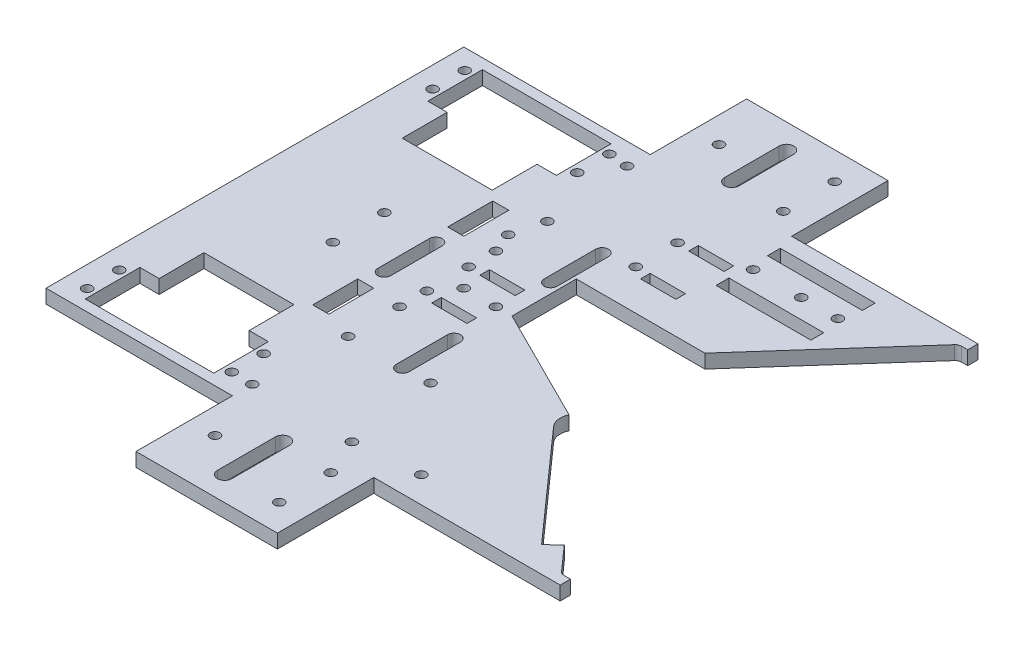
from build123d import *

# Parameters (mm, degrees)
BOSS_EXTRUDE1_DEPTH = 4.3
CUT_EXTRUDE1_DEPTH  = 4.5
FILLET1_R           = 2
CUT_EXTRUDE2_DEPTH  = 10
SKETCH8_R           = 1.5
CUT_EXTRUDE3_DEPTH  = 10
SKETCH9_R           = 1.5
CUT_EXTRUDE4_DEPTH  = 10
CUT_EXTRUDE5_DEPTH  = 10
SKETCH11_R          = 1.5
CUT_EXTRUDE6_DEPTH  = 10
SKETCH12_R          = 1.5
CUT_EXTRUDE7_DEPTH  = 10
SKETCH7_R           = 1.5
SKETCH7_W           = 11
SKETCH7_H           = 3
CUT_EXTRUDE8_DEPTH  = 9
SKETCH13_R          = 1.5
CUT_EXTRUDE9_DEPTH  = 10
SKETCH14_R          = 1.5
CUT_EXTRUDE10_DEPTH = 10
SKETCH15_W          = 5
SKETCH15_H          = 14
CUT_EXTRUDE11_DEPTH = 10
SKETCH16_R          = 1.5
CUT_EXTRUDE12_DEPTH = 10
SKETCH18_R          = 1.5
SKETCH18_W          = 29.5
SKETCH18_H          = 4
CUT_EXTRUDE13_DEPTH = 10


with BuildPart() as part:
    # Sketch2 → Boss-Extrude1 (new body)
    with BuildSketch(Plane(origin=(0, 0, 0), x_dir=(1, 0, 0), z_dir=(0, 1, 0))):
        Polygon((0, 0), (0, 65), (58, 65), (58, 95), (102, 95), (102, 65), (160, 65), (160, 0), align=None)
    extrude(amount=BOSS_EXTRUDE1_DEPTH)

    # Mirror1: part across plane


with BuildPart() as part_1:
    add(part.part)
    add(part.part.mirror(Plane(origin=(0, 4.3, 0), x_dir=(1, 0, 0), z_dir=(0, 0, -1))))

    # Sketch3 → Cut-Extrude1 (cut)
    with BuildSketch(Plane(origin=(0, 4.3, 0), x_dir=(1, 0, 0), z_dir=(0, 1, 0))):
        Polygon((160, -61.8), (160, 61.8), (157.156451185, 61.8), (120.012594795, 20), (80.012594795, 20), (80.012594795, 0), (120, -20), (157.155555556, -61.8), align=None)
    extrude(amount=-CUT_EXTRUDE1_DEPTH, mode=Mode.SUBTRACT)

    # Fillet1
    fillet1_edges = [part_1.edges().sort_by_distance(p)[0] for p in [
        (157.156451185, 2.15, -61.8),
        (157.155555556, 2.15, 61.8),
    ]]
    fillet(fillet1_edges, radius=FILLET1_R)

    # Sketch6 → Cut-Extrude2 (cut)
    with BuildSketch(Plane(origin=(0, 4.3, 0), x_dir=(1, 0, 0), z_dir=(0, 1, 0))):
        Polygon((9, -61.8), (49, -61.8), (49, -44.8), (43, -44.8), (43, -30.841820122), (15, -30.841820122), (15, -44.8), (9, -44.8), align=None)
        Polygon((9, 44.8), (15, 44.8), (15, 30.841820122), (43, 30.841820122), (43, 44.8), (49, 44.8), (49, 61.8), (9, 61.8), align=None)
    extrude(amount=-CUT_EXTRUDE2_DEPTH, mode=Mode.SUBTRACT)

    # Sketch8 → Cut-Extrude3 (cut)
    with BuildSketch(Plane(origin=(0, 4.3, 0), x_dir=(1, 0, 0), z_dir=(0, 1, 0))):
        with Locations((6.5, 58.8)):
            Circle(SKETCH8_R)
        with Locations((6.5, 48.8)):
            Circle(SKETCH8_R)
        with Locations((51.5, 48.8)):
            Circle(SKETCH8_R)
        with Locations((51.5, 58.8)):
            Circle(SKETCH8_R)
        with Locations((6.5, -48.7)):
            Circle(SKETCH8_R)
        with Locations((6.5, -58.7)):
            Circle(SKETCH8_R)
        with Locations((51.5, -58.7)):
            Circle(SKETCH8_R)
        with Locations((51.5, -48.8)):
            Circle(SKETCH8_R)
    extrude(amount=-CUT_EXTRUDE3_DEPTH, mode=Mode.SUBTRACT)

    # Sketch9 → Cut-Extrude4 (cut)
    with BuildSketch(Plane.XZ):
        with Locations((94, 70.4)):
            Circle(SKETCH9_R)
        with Locations((66, 78.4)):
            Circle(SKETCH9_R)
        with Locations((66, -78.4)):
            Circle(SKETCH9_R)
        with Locations((94, -86.4)):
            Circle(SKETCH9_R)
        with Locations((94, 86.4)):
            Circle(SKETCH9_R)
        with Locations((94, -70.4)):
            Circle(SKETCH9_R)
        with BuildLine():
            Line((75.75, 69.4), (75.75, 87.4))
            ThreePointArc((75.75, 87.4), (78, 89.65), (80.25, 87.4))
            Line((80.25, 87.4), (80.25, 69.4))
            ThreePointArc((80.25, 69.4), (78, 67.15), (75.75, 69.4))
        make_face()
        with BuildLine():
            Line((75.75, -87.4), (75.75, -70.4))
            ThreePointArc((75.75, -70.4), (78, -68.15), (80.25, -70.4))
            Line((80.25, -70.4), (80.25, -87.4))
            ThreePointArc((80.25, -87.4), (78, -89.65), (75.75, -87.4))
        make_face()
    extrude(amount=-CUT_EXTRUDE4_DEPTH, mode=Mode.SUBTRACT)

    # Sketch10 → Cut-Extrude5 (cut)
    with BuildSketch(Plane(origin=(0, 4.3, 0), x_dir=(1, 0, 0), z_dir=(0, 1, 0))):
        with BuildLine():
            Line((123.321819194, -23.737046593), (149.896372747, -53.633419341))
            Line((149.896372747, -53.633419341), (146.159326154, -56.955238535))
            Line((146.159326154, -56.955238535), (116.262953407, -23.321819194))
            ThreePointArc((116.262953407, -23.321819194), (120.29361011, -15.008628134), (123.321819194, -23.737046593))
        make_face()
    extrude(amount=-CUT_EXTRUDE5_DEPTH, mode=Mode.SUBTRACT)

    # Sketch11 → Cut-Extrude6 (cut)
    with BuildSketch(Plane.XZ):
        with BuildLine():
            ThreePointArc((79, 31.031280577), (77, 33.031280577), (75, 31.031280577))
            Line((75, 31.031280577), (75, 15.031280577))
            ThreePointArc((75, 15.031280577), (77, 13.031280577), (79, 15.031280577))
            Line((79, 15.031280577), (79, 31.031280577))
        make_face()
        with BuildLine():
            ThreePointArc((75, -31.031280577), (77, -33.031280577), (79, -31.031280577))
            Line((79, -31.031280577), (79, -15.031280577))
            ThreePointArc((79, -15.031280577), (77, -13.031280577), (75, -15.031280577))
            Line((75, -15.031280577), (75, -31.031280577))
        make_face()
        with Locations((60, 31)):
            Circle(SKETCH11_R)
        with Locations((60, 15)):
            Circle(SKETCH11_R)
        with Locations((60, -15)):
            Circle(SKETCH11_R)
        with Locations((60, -31)):
            Circle(SKETCH11_R)
    extrude(amount=-CUT_EXTRUDE6_DEPTH, mode=Mode.SUBTRACT)

    # Sketch12 → Cut-Extrude7 (cut)
    with BuildSketch(Plane(origin=(0, 0, 0), x_dir=(-1, 0, 0), z_dir=(0, -1, 0))):
        with BuildLine():
            ThreePointArc((-50.262723036, -8), (-48.262723036, -10), (-46.262723036, -8))
            Line((-46.262723036, -8), (-46.262723036, 8))
            ThreePointArc((-46.262723036, 8), (-48.262723036, 10), (-50.262723036, 8))
            Line((-50.262723036, 8), (-50.262723036, -8))
        make_face()
        with Locations((-32.262723036, -8)):
            Circle(SKETCH12_R)
        with Locations((-32.262723036, 8)):
            Circle(SKETCH12_R)
    extrude(amount=-CUT_EXTRUDE7_DEPTH, mode=Mode.SUBTRACT)

    # Sketch7 → Cut-Extrude8 (cut)
    with BuildSketch(Plane(origin=(0, 4.3, 0), x_dir=(1, 0, 0), z_dir=(0, 1, 0))):
        with Locations((60.012594795, -6.5)):
            Circle(SKETCH7_R)
        with Locations((60.012594795, 6.5)):
            Circle(SKETCH7_R)
        with Locations((86, 32.5)):
            Circle(SKETCH7_R)
        with Locations((86, 45.5)):
            Circle(SKETCH7_R)
        with Locations((69.5, -7.5)):
            Rectangle(SKETCH7_W, SKETCH7_H)
        with Locations((69.5, 7.5)):
            Rectangle(SKETCH7_W, SKETCH7_H)
        with Locations((95.487405205, 31.5)):
            Rectangle(SKETCH7_W, SKETCH7_H)
        with Locations((95.487405205, 46.5)):
            Rectangle(SKETCH7_W, SKETCH7_H)
    extrude(amount=-CUT_EXTRUDE8_DEPTH, mode=Mode.SUBTRACT)

    # Sketch13 → Cut-Extrude9 (cut)
    with BuildSketch(Plane(origin=(0, 4.3, 0), x_dir=(1, 0, 0), z_dir=(0, 1, 0))):
        with Locations((75, 0)):
            Circle(SKETCH13_R)
        with Locations((65, 0)):
            Circle(SKETCH13_R)
    extrude(amount=-CUT_EXTRUDE9_DEPTH, mode=Mode.SUBTRACT)

    # Sketch14 → Cut-Extrude10 (cut)
    with BuildSketch(Plane(origin=(0, 4.3, 0), x_dir=(1, 0, 0), z_dir=(0, 1, 0))):
        with Locations((57.5, 58.3)):
            Circle(SKETCH14_R)
        with Locations((57.5, 21.3)):
            Circle(SKETCH14_R)
        with Locations((85.370034901, -30.712866901)):
            Circle(SKETCH14_R)
        with Locations((108.62276926, -56.872193055)):
            Circle(SKETCH14_R)
    extrude(amount=-CUT_EXTRUDE10_DEPTH, mode=Mode.SUBTRACT)

    # Sketch15 → Cut-Extrude11 (cut)
    with BuildSketch(Plane(origin=(0, 4.3, 0), x_dir=(1, 0, 0), z_dir=(0, 1, 0))):
        with Locations((48.5, 21)):
            Rectangle(SKETCH15_W, SKETCH15_H)
        with Locations((48.5, -21)):
            Rectangle(SKETCH15_W, SKETCH15_H)
    extrude(amount=-CUT_EXTRUDE11_DEPTH, mode=Mode.SUBTRACT)

    # Sketch16 → Cut-Extrude12 (cut)
    with BuildSketch(Plane(origin=(0, 4.3, 0), x_dir=(1, 0, 0), z_dir=(0, 1, 0))):
        with Locations((89, -58.8)):
            Circle(SKETCH16_R)
        with Locations((58, -58.8)):
            Circle(SKETCH16_R)
    extrude(amount=-CUT_EXTRUDE12_DEPTH, mode=Mode.SUBTRACT)

    # Sketch18 → Cut-Extrude13 (cut)
    with BuildSketch(Plane(origin=(0, 4.3, 0), x_dir=(1, 0, 0), z_dir=(0, 1, 0))):
        with Locations((131.4, 50)):
            Circle(SKETCH18_R)
        with Locations((120, 50)):
            Circle(SKETCH18_R)
        with Locations((105, 50)):
            Circle(SKETCH18_R)
        with Locations((118.25, 58)):
            Rectangle(SKETCH18_W, SKETCH18_H)
        with Locations((118.25, 42)):
            Rectangle(SKETCH18_W, SKETCH18_H)
    extrude(amount=-CUT_EXTRUDE13_DEPTH, mode=Mode.SUBTRACT)


solid = part_1.part
